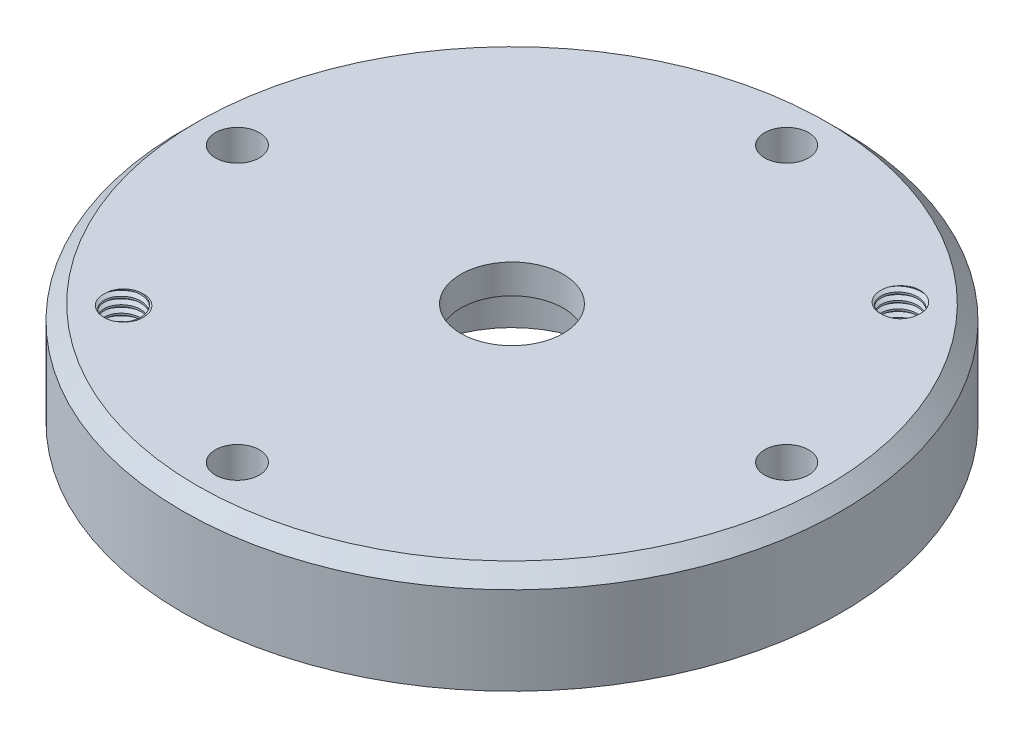
from build123d import *

# Parameters (mm, degrees)
SKETCH1_R           = 22.5
SKETCH1_R_2         = 15.1
BOSS_EXTRUDE1_DEPTH = 7
SKETCH2_R           = 16.994660615
SKETCH2_R_2         = 6.5
BOSS_EXTRUDE2_DEPTH = 6
SKETCH3_R           = 13.295859026
SKETCH3_R_2         = 3.5
BOSS_EXTRUDE3_DEPTH = 2
SKETCH4_R           = 1.5
SKETCH4_R_2         = 1.25
CUT_EXTRUDE1_DEPTH  = 10
CHAMFER1_SIZE       = 1
THREAD1_PITCH       = 0.5
CIRPATTERN1_COUNT   = 2


with BuildPart() as part:
    # Sketch1 → Boss-Extrude1 (new body)
    with BuildSketch(Plane(origin=(0, 0, 0), x_dir=(1, 0, 0), z_dir=(0, 1, 0))):
        with Locations(Location((0, 0, 0), (0, 0, 270))):
            Circle(SKETCH1_R)
        with Locations(Location((0, 0, 0), (0, 0, 270))):
            Circle(SKETCH1_R_2, mode=Mode.SUBTRACT)
    extrude(amount=BOSS_EXTRUDE1_DEPTH)

    # Sketch2 → Boss-Extrude2 (add)
    with BuildSketch(Plane(origin=(0, 7, 0), x_dir=(1, 0, 0), z_dir=(0, 1, 0))):
        Circle(SKETCH2_R)
        with Locations(Location((0, 0, 0), (0, 0, 270))):
            Circle(SKETCH2_R_2, mode=Mode.SUBTRACT)
    extrude(amount=-BOSS_EXTRUDE2_DEPTH)

    # Sketch3 → Boss-Extrude3 (add)
    with BuildSketch(Plane(origin=(0, 7, 0), x_dir=(1, 0, 0), z_dir=(0, 1, 0))):
        Circle(SKETCH3_R)
        with Locations(Location((0, 0, 0), (0, 0, 270))):
            Circle(SKETCH3_R_2, mode=Mode.SUBTRACT)
    extrude(amount=-BOSS_EXTRUDE3_DEPTH)

    # Sketch4 → Cut-Extrude1 (cut)
    with BuildSketch(Plane(origin=(0, 7, 0), x_dir=(1, 0, 0), z_dir=(0, 1, 0))):
        with Locations(Location((0, 18.75, 0), (0, 0, 270))):
            Circle(SKETCH4_R)
        with Locations(Location((-18.75, 0, 0), (0, 0, 270))):
            Circle(SKETCH4_R)
        with Locations(Location((0, -18.75, 0), (0, 0, 270))):
            Circle(SKETCH4_R)
        with Locations(Location((18.75, 0, 0), (0, 0, 270))):
            Circle(SKETCH4_R)
        with Locations(Location((-13.258252147, -13.258252147, 0), (0, 0, 270))):
            Circle(SKETCH4_R_2)
        with Locations(Location((13.258252147, 13.258252147, 0), (0, 0, 270))):
            Circle(SKETCH4_R_2)
    extrude(amount=-CUT_EXTRUDE1_DEPTH, mode=Mode.SUBTRACT)

    # Chamfer1
    chamfer1_edges = [part.edges().sort_by_distance(p)[0] for p in [
        (0, 7, -22.5),
    ]]
    chamfer(chamfer1_edges, length=CHAMFER1_SIZE)

    # Thread1: the profile of Thread Profile2 profile screwed along a right-hand helix of 16 turns, 6 arcs to a turn; built about Z, then put on its axis
    thread1_z = Axis((0, 0, 0), (0, 0, 1))
    thread1_corners = [(1.2497, 0, -0.000173205), (1.520632938, 0, 0.156249999), (1.520632938, 0, 0.218749999), (1.2497, 0, 0.375173204)]
    with BuildLine(mode=Mode.PRIVATE) as thread1_profile:
        Line(thread1_corners[0], thread1_corners[1])
        Line(thread1_corners[1], thread1_corners[2])
        Line(thread1_corners[2], thread1_corners[3])
        Line(thread1_corners[3], thread1_corners[0])
    thread1_cap = Face(thread1_profile.wire())
    thread1_turn_angles = [0, 30, 60, 90, 120, 150, 180, 210, 240, 270, 300, 330, 360]
    thread1_turn_weights = [1, 0.8660254037844387, 1, 0.8660254037844387, 1, 0.8660254037844387, 1, 0.8660254037844387, 1, 0.8660254037844387, 1, 0.8660254037844387, 1]
    thread1_turn_rails = [Edge.make_bspline([Vector(p[0], p[1], 0).rotate(thread1_z, thread1_turn_angles[k]) / thread1_turn_weights[k] + Vector(0, 0, p[2] + THREAD1_PITCH * thread1_turn_angles[k] / 360) for k in range(13)], [0, 0, 0, 1, 1, 2, 2, 3, 3, 4, 4, 5, 5, 6, 6, 6], 2, thread1_turn_weights) for p in thread1_corners]
    thread1_turn_sides = [Face.make_surface_from_curves(thread1_turn_rails[p[0]], thread1_turn_rails[p[1]]) for p in [(0, 1), (1, 2), (2, 3), (3, 0)]]
    thread1 = Plane(origin=(-13.258252147, 8, 13.258252147), x_dir=(-1, 0, 0), z_dir=(0, -1, 0)) * Solid(Shell([*[p.moved(Location((0, 0, THREAD1_PITCH * i))) for i in range(16) for p in thread1_turn_sides], thread1_cap, thread1_cap.rotate(thread1_z, 5760).moved(Location((0, 0, THREAD1_PITCH * 5760 / 360)))]))
    add(thread1, mode=Mode.SUBTRACT)

    # CirPattern1: Thread1 ×2 about axis
    cirpattern1_axis = Axis((0, 7, 0), (0, 1, 0))
    for i in range(1, CIRPATTERN1_COUNT):
        add(thread1.rotate(cirpattern1_axis, i * 360 / CIRPATTERN1_COUNT), mode=Mode.SUBTRACT)


solid = part.part
